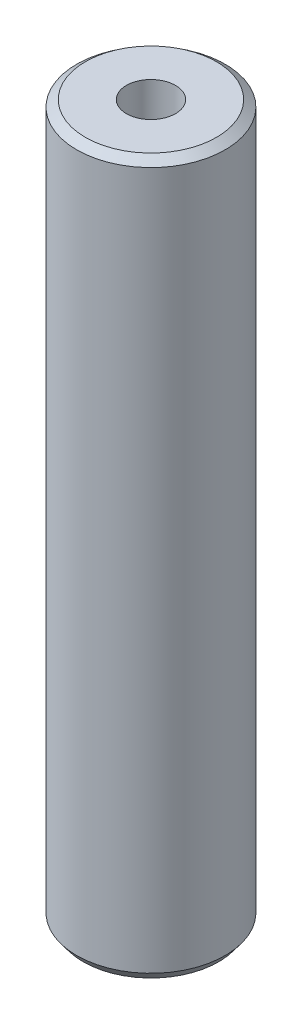
from build123d import *
from OCP.BRepFilletAPI import BRepFilletAPI_MakeChamfer

# Parameters (mm, degrees)
SKETCH1_R           = 7.5
BOSS_EXTRUDE1_DEPTH = 72.026188265
SKETCH2_R           = 2.479730428
CUT_EXTRUDE1_DEPTH  = 73.802965571
CHAMFER1_SIZE       = 0.653224859
CHAMFER1_SIZE2      = 0.875293475


with BuildPart() as part:
    # Sketch1 → Boss-Extrude1 (new body)
    with BuildSketch(Plane(origin=(0, 0, 0), x_dir=(1, 0, 0), z_dir=(0, 1, 0))):
        Circle(SKETCH1_R)
    extrude(amount=BOSS_EXTRUDE1_DEPTH)

    # Sketch2 → Cut-Extrude1 (cut, through all)
    with BuildSketch(Plane(origin=(0, 0, 0), x_dir=(1, 0, 0), z_dir=(0, 1, 0))):
        Circle(SKETCH2_R)
    extrude(amount=CUT_EXTRUDE1_DEPTH, mode=Mode.SUBTRACT)

    # Chamfer1: one chamfer whose edges measure the first distance from different faces: ONE call of the kernel's chamfer builder (chamfer() names one face for all edges)
    chamfer1_edges_1 = [part.edges().sort_by_distance(p)[0] for p in [
        (-7.5, 72.026188265, 0),
    ]]
    chamfer1_side_1 = [part.faces().sort_by_distance(p)[0] for p in [
        (-7.5, 36.013094133, 0),
    ]]
    chamfer1_edges_2 = [part.edges().sort_by_distance(p)[0] for p in [
        (-7.5, 0, 0),
    ]]
    chamfer1_side_2 = [part.faces().sort_by_distance(p)[0] for p in [
        (-7.287867966, 0, 0),
    ]]
    chamfer1 = BRepFilletAPI_MakeChamfer(part.part.solid().wrapped)
    for e in chamfer1_edges_1:
        chamfer1.Add(CHAMFER1_SIZE, CHAMFER1_SIZE2, e.wrapped, chamfer1_side_1[0].wrapped)  # the first distance lies on this face
    for e in chamfer1_edges_2:
        chamfer1.Add(CHAMFER1_SIZE, CHAMFER1_SIZE2, e.wrapped, chamfer1_side_2[0].wrapped)  # the first distance lies on this face
    add(Compound.cast(chamfer1.Shape()), mode=Mode.REPLACE)


solid = part.part
